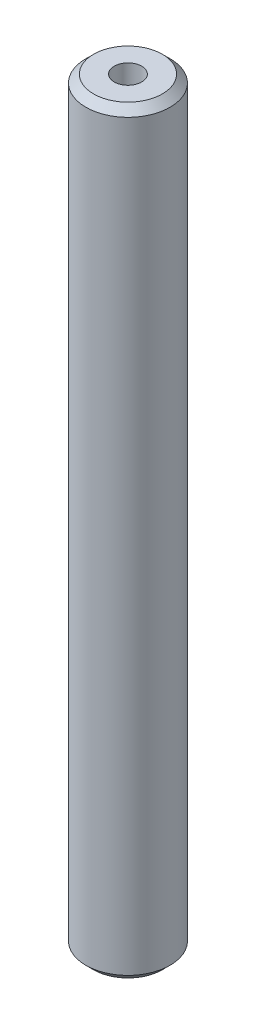
from build123d import *

# Parameters (mm, degrees)
SKETCH1_R           = 12.5
BOSS_EXTRUDE1_DEPTH = 225.239247243
SKETCH2_R           = 4.077925324
CUT_EXTRUDE1_DEPTH  = 226.93188907
CHAMFER1_SIZE       = 2.286072781


with BuildPart() as part:
    # Sketch1 → Boss-Extrude1 (new body)
    with BuildSketch(Plane(origin=(0, 0, 0), x_dir=(1, 0, 0), z_dir=(0, 1, 0))):
        Circle(SKETCH1_R)
    extrude(amount=BOSS_EXTRUDE1_DEPTH)

    # Sketch2 → Cut-Extrude1 (cut, through all)
    with BuildSketch(Plane(origin=(0, 0, 0), x_dir=(1, 0, 0), z_dir=(0, 1, 0))):
        Circle(SKETCH2_R)
    extrude(amount=CUT_EXTRUDE1_DEPTH, mode=Mode.SUBTRACT)

    # Chamfer1
    chamfer1_edges = [part.edges().sort_by_distance(p)[0] for p in [
        (-12.5, 225.239247243, 0),
        (-12.5, 0, 0),
    ]]
    chamfer(chamfer1_edges, length=CHAMFER1_SIZE)


solid = part.part
